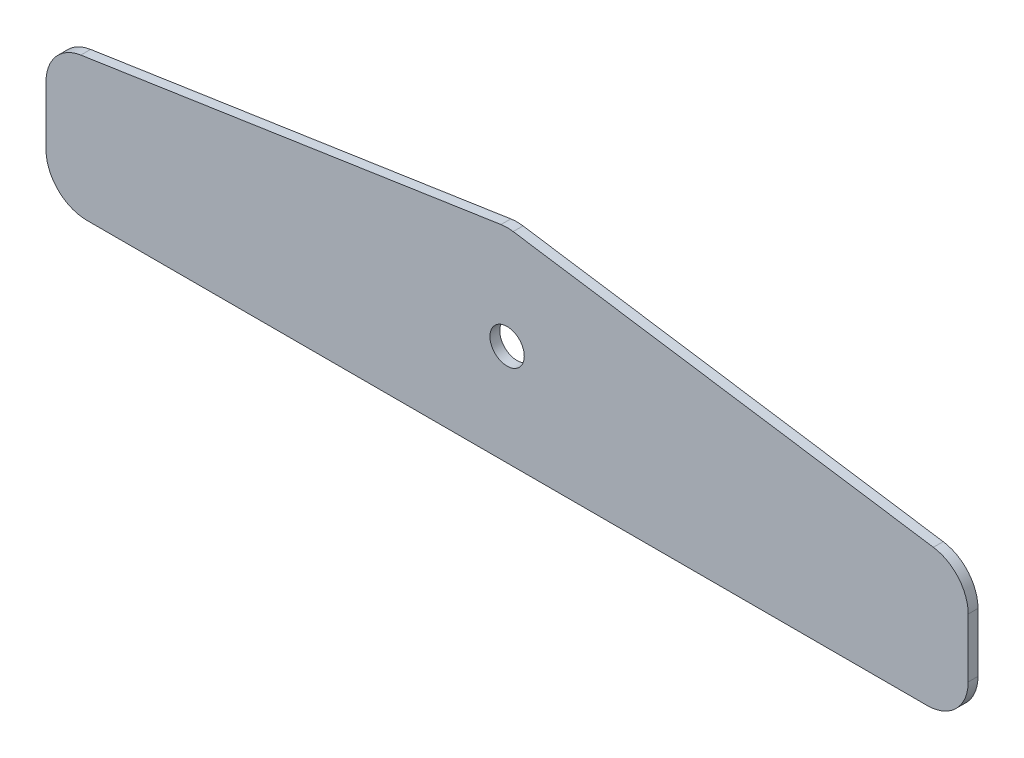
from build123d import *

# Parameters (mm, degrees)
SKETCH1_R           = 2.1
BOSS_EXTRUDE1_DEPTH = 1.2
FILLET1_R           = 5


with BuildPart() as part:
    # Sketch1 → Boss-Extrude1 (new body)
    with BuildSketch(Plane.XY):
        Polygon((-56.4, 131.138335016), (-56.4, 114.638335016), (56.4, 114.638335016), (56.4, 131.138335016), (0, 139.638335016), align=None)
        with Locations((0, 127)):
            Circle(SKETCH1_R, mode=Mode.SUBTRACT)
    extrude(amount=BOSS_EXTRUDE1_DEPTH)

    # Fillet1
    fillet1_edges = [part.edges().sort_by_distance(p)[0] for p in [
        (56.4, 114.638335016, 0.6),
        (-56.4, 114.638335016, 0.6),
        (56.4, 131.138335016, 0.6),
        (0, 139.638335016, 0.6),
        (-56.4, 131.138335016, 0.6),
    ]]
    fillet(fillet1_edges, radius=FILLET1_R)


solid = part.part
